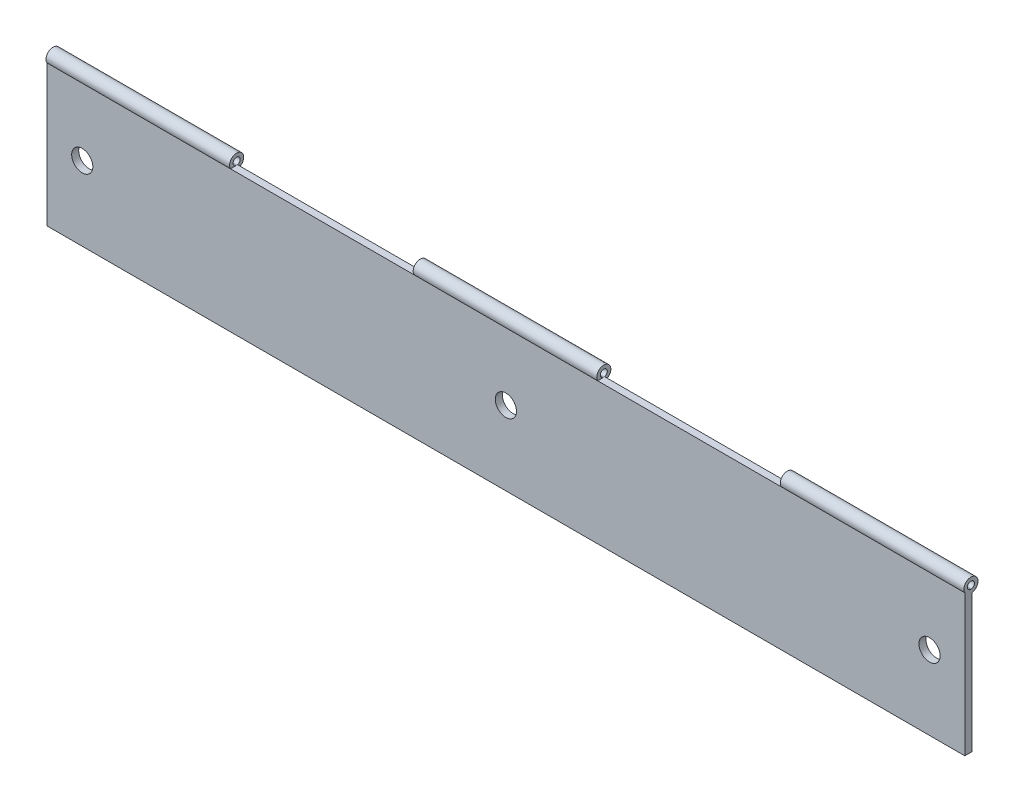
from build123d import *

# Parameters (mm, degrees)
SKETCH1_W           = 130
SKETCH1_H           = 20
SKETCH1_R           = 1.5
BOSS_EXTRUDE1_DEPTH = 1
SKETCH3_R           = 1
SKETCH3_R_2         = 0.5
BOSS_EXTRUDE3_DEPTH = 26
LPATTERN1_COUNT     = 3
LPATTERN1_PITCH     = 52


with BuildPart() as part:
    # Sketch1 → Boss-Extrude1 (new body)
    with BuildSketch(Plane.XY):
        with Locations((65, 10)):
            Rectangle(SKETCH1_W, SKETCH1_H)
        with Locations((65, 10.5)):
            Circle(SKETCH1_R, mode=Mode.SUBTRACT)
        with Locations((5, 10.5)):
            Circle(SKETCH1_R, mode=Mode.SUBTRACT)
        with Locations((125, 10.5)):
            Circle(SKETCH1_R, mode=Mode.SUBTRACT)
    extrude(amount=BOSS_EXTRUDE1_DEPTH)

    # Sketch3 → Boss-Extrude3 (add)
    with BuildSketch(Plane(origin=(0, 0, 0), x_dir=(0, 0, -1), z_dir=(1, 0, 0))):
        with Locations((-0.131588459, 20.495844124)):
            Circle(SKETCH3_R)
        with Locations((-0.131588459, 20.495844124)):
            Circle(SKETCH3_R_2, mode=Mode.SUBTRACT)
    boss_extrude3 = extrude(amount=BOSS_EXTRUDE3_DEPTH)

    # LPattern1: Boss-Extrude3 ×3
    with Locations(*[(i * LPATTERN1_PITCH, 0, 0) for i in range(1, LPATTERN1_COUNT)]):
        add(boss_extrude3)


solid = part.part
